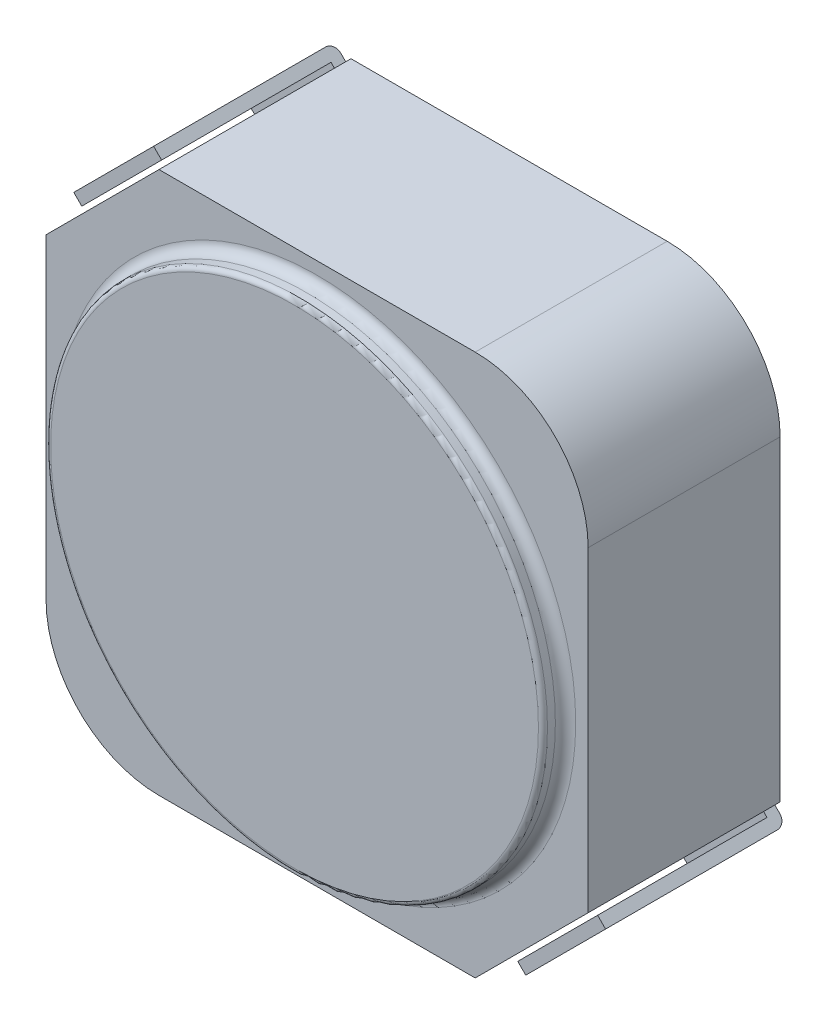
from build123d import *

# Parameters (mm, degrees)
EXTRUDE_START       = 0.1
EXTRUDE_1_DEPTH     = 1.7
SKETCH_6_R          = 2
CUT_EXTRUDE_5_DEPTH = 0.3
SKETCH_8_R          = 1.7
EXTRUDE_9_DEPTH     = 0.25
EXTRUDE_START_2     = 1.5
SKETCH_9_R          = 2.2
EXTRUDE_1_2_DEPTH   = 0.5
FILLET_2_R          = 0.09
FILLET_3_R          = 0.04
EXTRUDE_2_DEPTH     = 0.1
EXTRUDE_START_3     = 2.73
SKETCH_11_W         = 1.5
SKETCH_11_H         = 1
EXTRUDE_3_DEPTH     = 0.1
EXTRUDE_START_4     = -2.73
SKETCH_11_2_W       = 1.5
SKETCH_11_2_H       = 1
EXTRUDE_4_DEPTH     = 0.1
EXTRUDE_START_5     = 0.5
EXTRUDE_5_DEPTH     = 1


with BuildPart() as part:
    # Эскиз2 → Extrude 1 (new body)
    with BuildSketch(Plane.XY.offset(EXTRUDE_START)):
        with BuildLine():
            Line((-1.4, 2.4), (1.4, 2.4))
            ThreePointArc((1.4, 2.4), (2.107106781, 2.107106781), (2.4, 1.4))
            Line((2.4, 1.4), (2.4, -1.4))
            Line((2.4, -1.4), (1.4, -2.4))
            Line((1.4, -2.4), (-1.4, -2.4))
            ThreePointArc((-1.4, -2.4), (-2.107106781, -2.107106781), (-2.4, -1.4))
            Line((-2.4, -1.4), (-2.4, 1.4))
            Line((-2.4, 1.4), (-1.4, 2.4))
        make_face()
    extrude(amount=EXTRUDE_1_DEPTH)

    # Эскиз6 → Вытянуть5 (cut)
    with BuildSketch(Plane.XY):
        Circle(SKETCH_6_R)
    extrude(amount=CUT_EXTRUDE_5_DEPTH, mode=Mode.SUBTRACT)

    # Эскиз8 → Вытянуть9 (add)
    with BuildSketch(Plane.XY.offset(EXTRUDE_START)):
        Circle(SKETCH_8_R)
    extrude(amount=EXTRUDE_9_DEPTH)

    # Эскиз9 → Extrude 1 2 (add)
    with BuildSketch(Plane.XY.offset(EXTRUDE_START_2)):
        Circle(SKETCH_9_R)
    extrude(amount=EXTRUDE_1_2_DEPTH)

    # Скругление2
    fillet_2_edges = [part.edges().sort_by_distance(p)[0] for p in [
        (-2.2, 0, 1.8),
    ]]
    fillet(fillet_2_edges, radius=FILLET_2_R)

    # Скругление3
    fillet_3_edges = [part.edges().sort_by_distance(p)[0] for p in [
        (-2.2, 0, 2),
    ]]
    fillet(fillet_3_edges, radius=FILLET_3_R)

    # Эскиз10 → Бобышка-Вытянуть2 (add)
    with BuildSketch(Plane.XY):
        with BuildLine():
            Line((2.25, 0.75), (1.5, 0.75))
            ThreePointArc((1.5, 0.75), (0, 1.677050983), (-1.5, 0.75))
            Line((-1.5, 0.75), (-2.25, 0.75))
            Line((-2.25, 0.75), (-2.25, 1.55))
            Line((-2.25, 1.55), (-1.55, 2.25))
            Line((-1.55, 2.25), (1.5, 2.25))
            Line((1.5, 2.25), (2.25, 1.5))
            Line((2.25, 1.5), (2.25, 0.75))
        make_face()
        with BuildLine():
            Line((-2.25, -0.75), (-1.5, -0.75))
            ThreePointArc((-1.5, -0.75), (0, -1.677050983), (1.5, -0.75))
            Line((1.5, -0.75), (2.25, -0.75))
            Line((2.25, -0.75), (2.25, -1.55))
            Line((2.25, -1.55), (1.55, -2.25))
            Line((1.55, -2.25), (-1.5, -2.25))
            Line((-1.5, -2.25), (-2.25, -1.5))
            Line((-2.25, -1.5), (-2.25, -0.75))
        make_face()
    extrude(amount=EXTRUDE_2_DEPTH)



with BuildPart() as body_2:
    # Эскиз11 → Бобышка-Вытянуть3 (new body)
    with BuildSketch(Plane(origin=(0, 0, 0), x_dir=(0, 0, -1), z_dir=(0.7071067811865488, -0.7071067811865462, 0)).offset(EXTRUDE_START_3)):
        with Locations((-0.85, 0)):
            Rectangle(SKETCH_11_W, SKETCH_11_H)
    extrude(amount=EXTRUDE_3_DEPTH)


with BuildPart() as body_3:
    # Эскиз11<2> → Бобышка-Вытянуть4 (new body)
    with BuildSketch(Plane(origin=(0, 0, 0), x_dir=(0, 0, -1), z_dir=(0.7071067811865488, -0.7071067811865462, 0)).offset(EXTRUDE_START_4)):
        with Locations((-0.85, 0)):
            Rectangle(SKETCH_11_2_W, SKETCH_11_2_H)
    extrude(amount=-EXTRUDE_4_DEPTH)


with BuildPart() as part_1:
    add(part.part)

    add(body_2.part)  # Бобышка-Вытянуть5 merges body 2

    add(body_3.part)  # Бобышка-Вытянуть5 merges body 3
    # Эскиз12 → Бобышка-Вытянуть5 (add)
    with BuildSketch(Plane(origin=(0, 0, 0), x_dir=(0.7071067811865488, -0.7071067811865462, 0), z_dir=(-0.7071067811865462, -0.7071067811865488, 0)).offset(EXTRUDE_START_5)):
        with BuildLine():
            Line((2.83, 0.15), (2.83, 0.08))
            ThreePointArc((2.83, 0.08), (2.806568542, 0.023431458), (2.75, 0))
            Line((2.75, 0), (2.6, 0))
            Line((2.6, 0), (2.6, 0.1))
            Line((2.6, 0.1), (2.73, 0.1))
            Line((2.73, 0.1), (2.73, 0.15))
            Line((2.73, 0.15), (2.83, 0.15))
        make_face()
        with BuildLine():
            Line((-2.6, 0.1), (-2.6, 0))
            Line((-2.6, 0), (-2.75, 0))
            ThreePointArc((-2.75, 0), (-2.806568542, 0.023431458), (-2.83, 0.08))
            Line((-2.83, 0.08), (-2.83, 0.15))
            Line((-2.83, 0.15), (-2.73, 0.15))
            Line((-2.73, 0.15), (-2.73, 0.1))
            Line((-2.73, 0.1), (-2.6, 0.1))
        make_face()
    extrude(amount=-EXTRUDE_5_DEPTH)


solid = part_1.part
